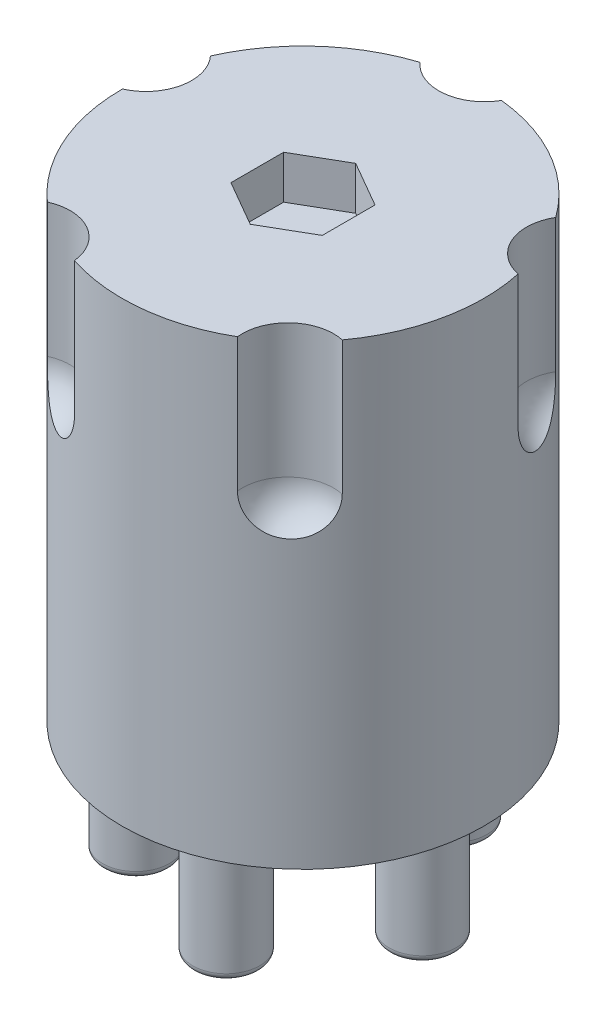
from build123d import *

# Parameters (mm, degrees)
SKETCH1_R           = 25.75
BOSS_EXTRUDE1_DEPTH = 65
SKETCH2_R           = 4.75
BOSS_EXTRUDE2_DEPTH = 18
FILLET1_R           = 1
FILLET2_R           = 1
CUT_EXTRUDE1_DEPTH  = 6.15
SKETCH4_R           = 10
CUT_EXTRUDE2_DEPTH  = 22
SKETCH5_R           = 4
CUT_EXTRUDE3_DEPTH  = 11.5
CHAMFER2_SIZE       = 5
SKETCH6_R           = 6.5
CUT_EXTRUDE4_DEPTH  = 25
FILLET3_R           = 6


with BuildPart() as part:
    # Sketch1 → Boss-Extrude1 (new body)
    with BuildSketch(Plane(origin=(0, 0, 0), x_dir=(1, 0, 0), z_dir=(0, 1, 0))):
        with Locations(Location((0, 0, 0), (0, 0, 270))):
            Circle(SKETCH1_R)
    extrude(amount=BOSS_EXTRUDE1_DEPTH)

    # Sketch2 → Boss-Extrude2 (add)
    with BuildSketch(Plane.XZ):
        with Locations(Location((17, 0, 0), (0, 0, 90))):
            Circle(SKETCH2_R)
        with Locations(Location((5.253288904, -16.167960777, 0), (0, 0, 90))):
            Circle(SKETCH2_R)
        with Locations(Location((-13.753288904, -9.992349289, 0), (0, 0, 90))):
            Circle(SKETCH2_R)
        with Locations(Location((-13.753288904, 9.992349289, 0), (0, 0, 90))):
            Circle(SKETCH2_R)
        with Locations(Location((5.253288904, 16.167960777, 0), (0, 0, 90))):
            Circle(SKETCH2_R)
    extrude(amount=BOSS_EXTRUDE2_DEPTH)

    # Fillet1
    fillet1_edges = [part.edges().sort_by_distance(p)[0] for p in [
        (-13.753288904, 0, -14.742349289),
        (-13.753288904, 0, 5.242349289),
        (5.253288904, 0, 11.417960777),
        (17, 0, -4.75),
        (5.253288904, 0, -20.917960777),
    ]]
    fillet(fillet1_edges, radius=FILLET1_R)

    # Fillet2
    fillet2_edges = [part.edges().sort_by_distance(p)[0] for p in [
        (-13.753288904, -18, -14.742349289),
        (-13.753288904, -18, 5.242349289),
        (5.253288904, -18, 11.417960777),
        (17, -18, -4.75),
        (5.253288904, -18, -20.917960777),
    ]]
    fillet(fillet2_edges, radius=FILLET2_R)

    # Sketch3 → Cut-Extrude1 (cut)
    with BuildSketch(Plane(origin=(0, 65, 0), x_dir=(1, 0, 0), z_dir=(0, 1, 0))):
        Polygon((0, -7.5), (6.495190528, -3.75), (6.495190528, 3.75), (0, 7.5), (-6.495190528, 3.75), (-6.495190528, -3.75), align=None)
    extrude(amount=-CUT_EXTRUDE1_DEPTH, mode=Mode.SUBTRACT)

    # Sketch4 → Cut-Extrude2 (cut)
    with BuildSketch(Plane.XZ):
        with Locations(Location((0, 0, 0), (0, 0, 270))):
            Circle(SKETCH4_R)
    extrude(amount=-CUT_EXTRUDE2_DEPTH, mode=Mode.SUBTRACT)

    # Sketch5 → Cut-Extrude3 (cut)
    with BuildSketch(Plane.XZ.offset(-22)):
        with Locations(Location((0, 0, 0), (0, 0, 270))):
            Circle(SKETCH5_R)
    extrude(amount=-CUT_EXTRUDE3_DEPTH, mode=Mode.SUBTRACT)

    # Chamfer2
    chamfer2_edges = [part.edges().sort_by_distance(p)[0] for p in [
        (0, 22, 4),
    ]]
    chamfer(chamfer2_edges, length=CHAMFER2_SIZE)

    # Sketch6 → Cut-Extrude4 (cut)
    with BuildSketch(Plane(origin=(0, 65, 0), x_dir=(1, 0, 0), z_dir=(0, 1, 0))):
        with Locations((-14.5, -25.11473671)):
            Circle(SKETCH6_R)
        with Locations((-28.366280421, 6.029439034)):
            Circle(SKETCH6_R)
        with Locations((-3.031325435, 28.841134966)):
            Circle(SKETCH6_R)
        with Locations((26.492818272, 11.795362649)):
            Circle(SKETCH6_R)
        with Locations((19.404787584, -21.551199939)):
            Circle(SKETCH6_R)
    extrude(amount=-CUT_EXTRUDE4_DEPTH, mode=Mode.SUBTRACT)

    # Fillet3
    # the kernel refuses this fillet: 6 mm, written as the material it adds along each edge
    with BuildSketch(Plane(origin=(-14.5, 40, 25.11473671), x_dir=(-0.49727683802994654, 0, 0.8675919238668247), z_dir=(-0.8675919238668247, 0, -0.49727683802994654))) as fillet3_piece_1_section:
        with BuildLine():
            CenterArc((6.5 - FILLET3_R, FILLET3_R), FILLET3_R, 270, 90)
            Line((6.5, FILLET3_R), (6.5, 0))
            Line((6.5, 0), (6.5 - FILLET3_R, 0))
        make_face()
    fillet3_piece_1 = revolve(axis=Axis((-14.5, 40, 25.11473671), (0, 1, 0)), revolution_arc=359.64, mode=Mode.PRIVATE)
    fillet3_piece_1 = fillet3_piece_1 & Plane(origin=(0, 41.717626999, 0), x_dir=(0, 0, 1), z_dir=(0, -1, 0)) * Cylinder(25.75, 26, mode=Mode.PRIVATE)
    add(fillet3_piece_1)
    with BuildSketch(Plane(origin=(26.492818272, 40, -11.795362649), x_dir=(0.9122631507322388, 0, -0.40960461889008104), z_dir=(0.40960461889008104, 0, 0.9122631507322388))) as fillet3_piece_2_section:
        with BuildLine():
            CenterArc((6.5 - FILLET3_R, FILLET3_R), FILLET3_R, 270, 90)
            Line((6.5, FILLET3_R), (6.5, 0))
            Line((6.5, 0), (6.5 - FILLET3_R, 0))
        make_face()
    fillet3_piece_2 = revolve(axis=Axis((26.492818272, 40, -11.795362649), (0, 1, 0)), revolution_arc=359.64, mode=Mode.PRIVATE)
    fillet3_piece_2 = fillet3_piece_2 & Plane(origin=(0, 41.717626999, 0), x_dir=(0, 0, 1), z_dir=(0, -1, 0)) * Cylinder(25.75, 27, mode=Mode.PRIVATE)
    add(fillet3_piece_2)
    with BuildSketch(Plane(origin=(-3.031325435, 40, -28.841134966), x_dir=(-0.10765232498170882, 0, -0.9941886022913522), z_dir=(0.9941886022913522, 0, -0.10765232498170882))) as fillet3_piece_3_section:
        with BuildLine():
            CenterArc((6.5 - FILLET3_R, FILLET3_R), FILLET3_R, 270, 90)
            Line((6.5, FILLET3_R), (6.5, 0))
            Line((6.5, 0), (6.5 - FILLET3_R, 0))
        make_face()
    fillet3_piece_3 = revolve(axis=Axis((-3.031325435, 40, -28.841134966), (0, 1, 0)), revolution_arc=359.64, mode=Mode.PRIVATE)
    fillet3_piece_3 = fillet3_piece_3 & Plane(origin=(0, 41.717626999, 0), x_dir=(0, 0, 1), z_dir=(0, -1, 0)) * Cylinder(25.75, 26, mode=Mode.PRIVATE)
    add(fillet3_piece_3)
    with BuildSketch(Plane(origin=(-28.366280421, 40, -6.029439034), x_dir=(-0.9774896010068019, 0, -0.2109836010773427), z_dir=(-0.2109836010773427, 0, 0.9774896010068019))) as fillet3_piece_4_section:
        with BuildLine():
            CenterArc((6.5 - FILLET3_R, -FILLET3_R), FILLET3_R, 0, 90)
            Line((6.5, -FILLET3_R), (6.5, 0))
            Line((6.5, 0), (6.5 - FILLET3_R, 0))
        make_face()
    fillet3_piece_4 = revolve(axis=Axis((-28.366280421, 40, -6.029439034), (0, -1, 0)), revolution_arc=359.64, mode=Mode.PRIVATE)
    fillet3_piece_4 = fillet3_piece_4 & Plane(origin=(0, 41.717627119, 0), x_dir=(0, 0, 1), z_dir=(0, -1, 0)) * Cylinder(25.75, 27, mode=Mode.PRIVATE)
    add(fillet3_piece_4)
    with BuildSketch(Plane(origin=(19.404787584, 40, 21.551199939), x_dir=(0.6714619588183012, 0, 0.7410390258683345), z_dir=(-0.7410390258683345, 0, 0.6714619588183012))) as fillet3_piece_5_section:
        with BuildLine():
            CenterArc((6.5 - FILLET3_R, FILLET3_R), FILLET3_R, 270, 90)
            Line((6.5, FILLET3_R), (6.5, 0))
            Line((6.5, 0), (6.5 - FILLET3_R, 0))
        make_face()
    fillet3_piece_5 = revolve(axis=Axis((19.404787584, 40, 21.551199939), (0, 1, 0)), revolution_arc=359.64, mode=Mode.PRIVATE)
    fillet3_piece_5 = fillet3_piece_5 & Plane(origin=(0, 41.717626999, 0), x_dir=(0, 0, 1), z_dir=(0, -1, 0)) * Cylinder(25.75, 27, mode=Mode.PRIVATE)
    add(fillet3_piece_5)


solid = part.part
